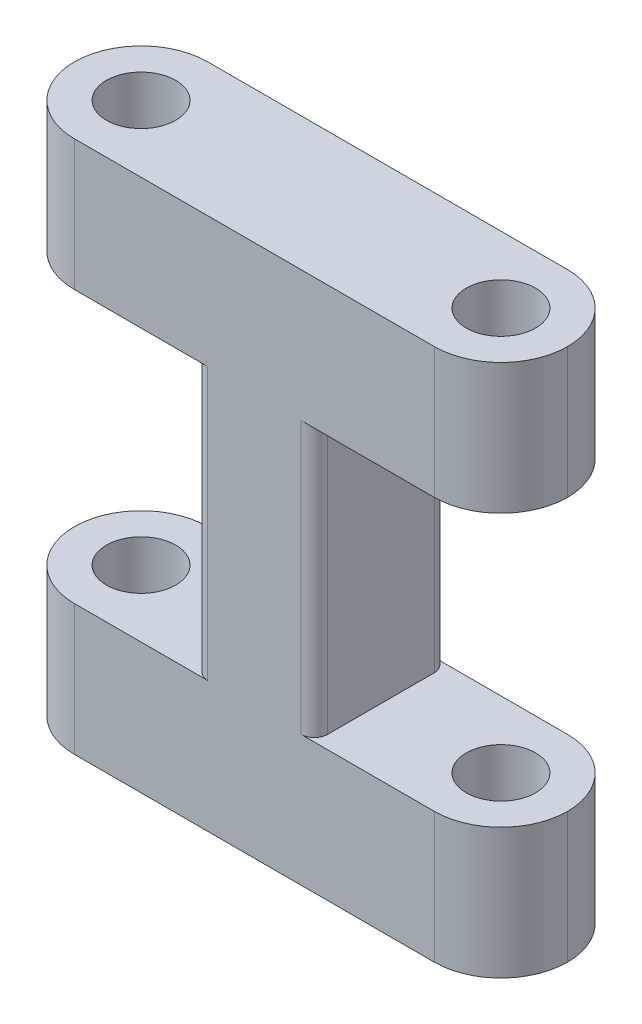
from build123d import *

# Parameters (mm, degrees)
BOSS_EXTRUDE2_DEPTH = 10
FILLET1_R           = 5
FILLET2_R           = 1
SKETCH2_R           = 2.6
CUT_EXTRUDE1_DEPTH  = 46.191260217


with BuildPart() as part:
    # Sketch1 → Boss-Extrude2 (new body)
    with BuildSketch(Plane.XY):
        Polygon((-18.5, -10.2), (-18.5, -20), (18.5, -20), (18.5, -10.2), (4.5, -10.2), (4.5, 10.2), (18.5, 10.2), (18.5, 20), (-18.5, 20), (-18.5, 10.2), (-4.5, 10.2), (-4.5, -10.2), align=None)
    extrude(amount=BOSS_EXTRUDE2_DEPTH)

    # Fillet1
    fillet1_edges = [part.edges().sort_by_distance(p)[0] for p in [
        (18.5, 15.1, 0),
        (18.5, 15.1, 10),
        (18.5, -15.1, 0),
        (18.5, -15.1, 10),
        (-18.5, 15.1, 0),
        (-18.5, -15.1, 0),
        (-18.5, -15.1, 10),
        (-18.5, 15.1, 10),
    ]]
    fillet(fillet1_edges, radius=FILLET1_R - 0.0001)  # a hair under: the kernel refuses the full size

    # Fillet2
    fillet2_edges = [part.edges().sort_by_distance(p)[0] for p in [
        (4.5, 0, 10),
        (-4.5, 0, 0),
        (4.5, 0, 0),
        (-4.5, 0, 10),
    ]]
    fillet(fillet2_edges, radius=FILLET2_R)

    # Sketch2 → Cut-Extrude1 (cut, through all)
    with BuildSketch(Plane.XZ.offset(20)):
        with Locations(Location((-13.5, 5, 0), (0, 0, 270))):
            Circle(SKETCH2_R)
        with Locations(Location((13.5, 5, 0), (0, 0, 270))):
            Circle(SKETCH2_R)
    extrude(amount=-CUT_EXTRUDE1_DEPTH, mode=Mode.SUBTRACT)


solid = part.part
